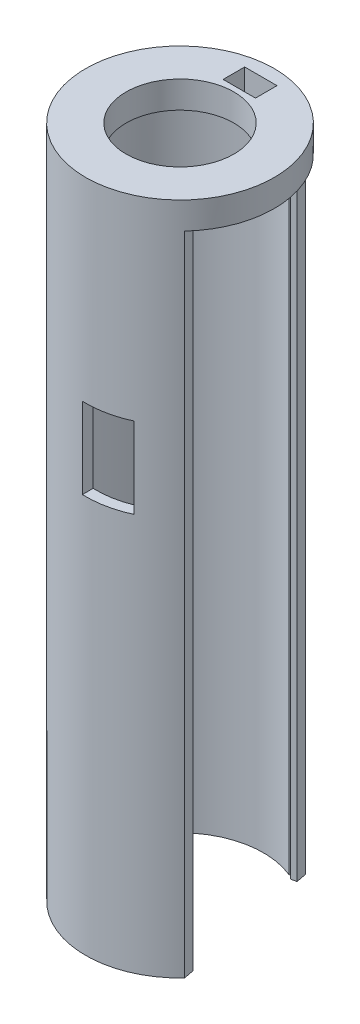
from build123d import *

# Parameters (mm, degrees)
BOSS_EXTRUDE1_DEPTH = 120
SKETCH13_R          = 17.5
SKETCH13_R_2        = 10
BOSS_EXTRUDE3_DEPTH = 5
SKETCH16_W          = 6
SKETCH16_H          = 4
CUT_EXTRUDE1_DEPTH  = 5
SKETCH17_W          = 8
SKETCH17_H          = 15
CUT_EXTRUDE2_DEPTH  = 150
SKETCH18_R          = 8
CUT_EXTRUDE5_DEPTH  = 20


with BuildPart() as part:
    # Sketch12 → Boss-Extrude1 (new body)
    with BuildSketch(Plane(origin=(0, 0, 0), x_dir=(1, 0, 0), z_dir=(0, 1, 0))):
        with BuildLine():
            Line((7.739637111, 13.974862184), (7.366516518, 15.874017588))
            ThreePointArc((7.366516518, 15.874017588), (-17.176710149, -3.348227659), (12.789248629, -11.945087672))
            Line((12.789248629, -11.945087672), (12.419575195, -10.047532416))
            Line((12.419575195, -10.047532416), (11.438034608, -10.23875187))
            Line((11.438034608, -10.23875187), (11.575438585, -10.950078857))
            Line((11.575438585, -10.950078857), (10.821653787, -11.096927922))
            ThreePointArc((10.821653787, -11.096927922), (-15.213979485, -2.963921091), (5.864646293, 14.347680086))
            Line((5.864646293, 14.347680086), (6.618431091, 14.494529151))
            Line((6.618431091, 14.494529151), (6.758096524, 13.78364273))
            Line((6.758096524, 13.78364273), (7.739637111, 13.974862184))
        make_face()
    extrude(amount=BOSS_EXTRUDE1_DEPTH)

    # Sketch13 → Boss-Extrude3 (add)
    with BuildSketch(Plane(origin=(0, 120, 0), x_dir=(1, 0, 0), z_dir=(0, 1, 0))):
        Circle(SKETCH13_R)
        Circle(SKETCH13_R_2, mode=Mode.SUBTRACT)
    extrude(amount=BOSS_EXTRUDE3_DEPTH)

    # Sketch16 → Cut-Extrude1 (cut)
    with BuildSketch(Plane(origin=(0, 125, 0), x_dir=(1, 0, 0), z_dir=(0, 1, 0))):
        with Locations((0, 13)):
            Rectangle(SKETCH16_W, SKETCH16_H)
    extrude(amount=-CUT_EXTRUDE1_DEPTH, mode=Mode.SUBTRACT)

    # Sketch17 → Cut-Extrude2 (cut)
    with BuildSketch(Plane.XY):
        with Locations((3.376565864, 81.232231727)):
            Rectangle(SKETCH17_W, SKETCH17_H)
    extrude(amount=CUT_EXTRUDE2_DEPTH, mode=Mode.SUBTRACT)

    # Sketch18 → Cut-Extrude5 (cut)
    with BuildSketch(Plane(origin=(0, 0, 0), x_dir=(0, 0, -1), z_dir=(1, 0, 0))):
        with Locations((0.164982811, 93.764242657)):
            Circle(SKETCH18_R)
    extrude(amount=-CUT_EXTRUDE5_DEPTH, mode=Mode.SUBTRACT)


solid = part.part
